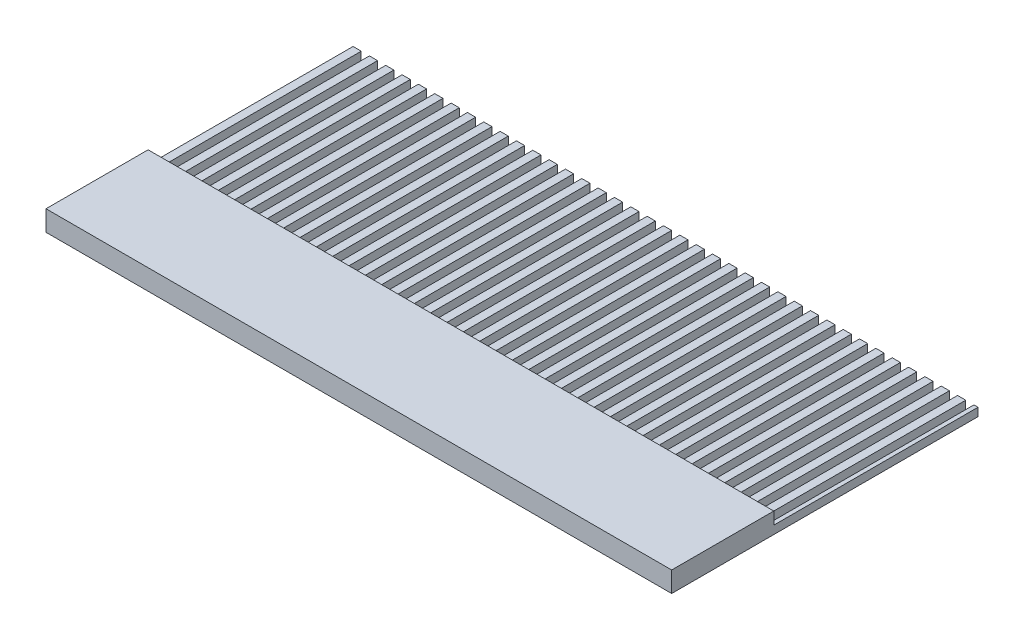
from build123d import *

# Parameters (mm, degrees)
SKETCH1_W           = 115
SKETCH1_H           = 15
BOSS_EXTRUDE1_DEPTH = 0.5
SKETCH2_W           = 115
SKETCH2_H           = 10
CUT_EXTRUDE1_DEPTH  = 0.1
SKETCH3_W           = 0.4
SKETCH3_H           = 10
CUT_EXTRUDE2_DEPTH  = 0.4
LPATTERN3_COUNT     = 150
LPATTERN3_PITCH     = 0.8
SKETCH4_W           = 115
SKETCH4_H           = 5
BOSS_EXTRUDE2_DEPTH = 1
SKETCH5_W           = 77.289086501
SKETCH5_H           = 15.822063322
CUT_EXTRUDE3_DEPTH  = 1
SKETCH6_W           = 3.197112069
SKETCH6_H           = 15.066627115
CUT_EXTRUDE4_DEPTH  = 1
SKETCH7_W           = 3.877656405
SKETCH7_H           = 15.126214191
CUT_EXTRUDE7_DEPTH  = 1


with BuildPart() as part:
    # Sketch1 → Boss-Extrude1 (new body)
    with BuildSketch(Plane(origin=(0, 0, 0), x_dir=(1, 0, 0), z_dir=(0, 1, 0))):
        with Locations((57.5, 7.5)):
            Rectangle(SKETCH1_W, SKETCH1_H)
    extrude(amount=BOSS_EXTRUDE1_DEPTH)

    # Sketch2 → Cut-Extrude1 (cut)
    with BuildSketch(Plane(origin=(0, 0.5, 0), x_dir=(1, 0, 0), z_dir=(0, 1, 0))):
        with Locations((57.5, 10)):
            Rectangle(SKETCH2_W, SKETCH2_H)
    extrude(amount=-CUT_EXTRUDE1_DEPTH, mode=Mode.SUBTRACT)

    # Sketch3 → Cut-Extrude2 (cut)
    with BuildSketch(Plane(origin=(0, 0.4, 0), x_dir=(1, 0, 0), z_dir=(0, 1, 0))):
        with Locations((0.2, 10)):
            Rectangle(SKETCH3_W, SKETCH3_H)
    cut_extrude2 = extrude(amount=-CUT_EXTRUDE2_DEPTH, mode=Mode.SUBTRACT)

    # LPattern3: Cut-Extrude2 ×150
    with Locations(*[(i * LPATTERN3_PITCH, 0, 0) for i in range(1, LPATTERN3_COUNT)]):
        add(cut_extrude2, mode=Mode.SUBTRACT)

    # Sketch4 → Boss-Extrude2 (add)
    with BuildSketch(Plane.XZ):
        with Locations((57.5, -2.5)):
            Rectangle(SKETCH4_W, SKETCH4_H)
    extrude(amount=-BOSS_EXTRUDE2_DEPTH)

    # Sketch5 → Cut-Extrude3 (cut)
    with BuildSketch(Plane(origin=(0, 1, 0), x_dir=(1, 0, 0), z_dir=(0, 1, 0))):
        with Locations((38.64454325, 7.911031661)):
            Rectangle(SKETCH5_W, SKETCH5_H)
    extrude(amount=-CUT_EXTRUDE3_DEPTH, mode=Mode.SUBTRACT)

    # Sketch6 → Cut-Extrude4 (cut)
    with BuildSketch(Plane(origin=(0, 1, 0), x_dir=(1, 0, 0), z_dir=(0, 1, 0))):
        with Locations((78.887642535, 7.533313558)):
            Rectangle(SKETCH6_W, SKETCH6_H)
    extrude(amount=-CUT_EXTRUDE4_DEPTH, mode=Mode.SUBTRACT)

    # Sketch7 → Cut-Extrude7 (cut)
    with BuildSketch(Plane(origin=(0, 1, 0), x_dir=(1, 0, 0), z_dir=(0, 1, 0))):
        with Locations((82.425026773, 7.563107096)):
            Rectangle(SKETCH7_W, SKETCH7_H)
    extrude(amount=-CUT_EXTRUDE7_DEPTH, mode=Mode.SUBTRACT)


solid = part.part
